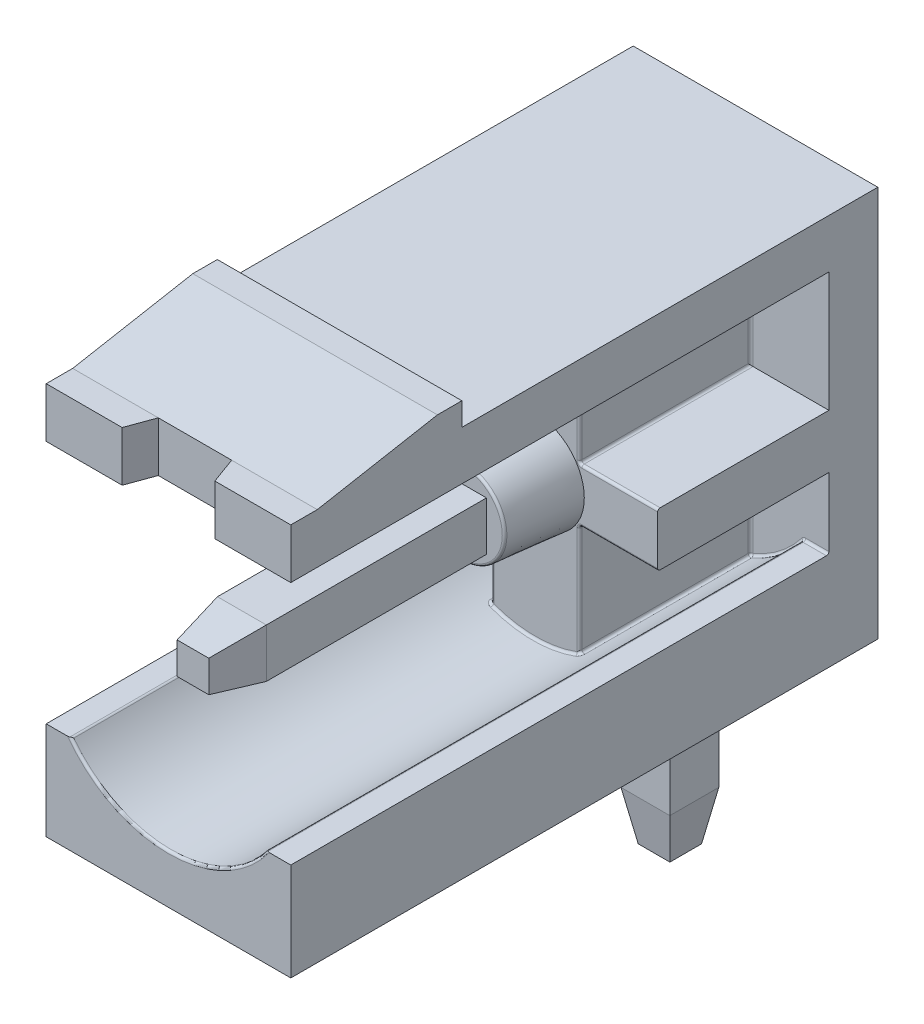
from build123d import *
from OCP.BRepFilletAPI import BRepFilletAPI_MakeChamfer

# Parameters (mm, degrees)
SKETCH_1_W                   = 5
SKETCH_1_H                   = 8
EXTRUDE_1_DEPTH              = 12
SKETCH_2_W                   = 5
SKETCH_2_H                   = 5
CUT_EXTRUDE_2_DEPTH          = 11
SKETCH_5_R                   = 2.5
CUT_EXTRUDE_3_DEPTH          = 11
EXTRUDE_START                = 3.5
SKETCH_13_W                  = 1.8
SKETCH_13_H                  = 1.1
SKETCH_13_H_2                = 2.45
SKETCH_13_W_2                = 1.6
EXTRUDE_13_DEPTH             = 3.5
SKETCH_14_R                  = 1
EXTRUDE_14_DEPTH             = 1.5
CHAMFER_1_SIZE               = 1.5
CHAMFER_1_SIZE_2             = 0.131232995
EXTRUDE_15_DEPTH             = 5
CUT_EXTRUDE_16_REACH         = 16.649
SKETCH_17_W                  = 1.2
SKETCH_17_H                  = 5
CUT_EXTRUDE_17_DEPTH         = 2.25
SKETCH_18_W                  = 3.5
SKETCH_18_H                  = 6
CUT_EXTRUDE_18_DEPTH         = 0.1
EXTRUDE_19_REACH             = 16.9
SKETCH_6_W                   = 1
SKETCH_6_H                   = 1
SKETCH_19_W                  = 1
SKETCH_19_H                  = 1
CUT_EXTRUDE_20_DEPTH         = 0.5
EXTRUDE_22_REACH             = 16.9
SKETCH_9_W                   = 1
SKETCH_9_H                   = 1
EXTRUDE_22_DIRECTION_2_DEPTH = 4
CHAMFER_2_SIZE               = 1
CHAMFER_2_SIZE2              = 0.176326981
CHAMFER_3_SIZE               = 1
CHAMFER_3_SIZE2              = 0.176326981
FILLET_3_R                   = 0.05


with BuildPart() as part:
    # Эскиз1 → Вытянуть1 (new body)
    with BuildSketch(Plane.XY):
        with Locations((0, 4)):
            Rectangle(SKETCH_1_W, SKETCH_1_H)
    extrude(amount=EXTRUDE_1_DEPTH)

    # Эскиз2 → Вытянуть2 (cut)
    with BuildSketch(Plane.XY.offset(12)):
        with Locations((0, 4.5)):
            Rectangle(SKETCH_2_W, SKETCH_2_H)
    extrude(amount=-CUT_EXTRUDE_2_DEPTH, mode=Mode.SUBTRACT)

    # Эскиз5 → Вытянуть3 (cut)
    with BuildSketch(Plane.XY.offset(12)):
        with Locations((0, 3.5)):
            Circle(SKETCH_5_R)
    extrude(amount=-CUT_EXTRUDE_3_DEPTH, mode=Mode.SUBTRACT)

    # Эскиз13 → Вытянуть13 (add)
    with BuildSketch(Plane.XY.offset(1).offset(EXTRUDE_START)):
        with Locations((0, 4)):
            Rectangle(SKETCH_13_W, SKETCH_13_H)
        with Locations((0, 5.775)):
            Rectangle(SKETCH_13_W, SKETCH_13_H_2)
        with Locations((-1.7, 4)):
            Rectangle(SKETCH_13_W_2, SKETCH_13_H)
        with BuildLine():
            ThreePointArc((-0.9, 1.167619242), (-0.457737974, 1.042262026), (0, 1))
            ThreePointArc((0, 1), (0.457737974, 1.042262026), (0.9, 1.167619242))
            Line((0.9, 1.167619242), (0.9, 3.45))
            Line((0.9, 3.45), (-0.9, 3.45))
            Line((-0.9, 3.45), (-0.9, 1.167619242))
        make_face()
        with Locations((1.7, 4)):
            Rectangle(SKETCH_13_W_2, SKETCH_13_H)
    extrude(amount=-EXTRUDE_13_DEPTH)

    # Эскиз14 → Вытянуть14 (add)
    with BuildSketch(Plane.XY.offset(4.5)):
        with Locations((0, 4)):
            Circle(SKETCH_14_R)
    extrude(amount=EXTRUDE_14_DEPTH)

    # Фаска1
    # the kernel refuses this chamfer: 1.5, 0.131232995 mm, written as the material it takes off along each edge
    with BuildSketch(Plane(origin=(0, 4, 6), x_dir=(1, 0, 0), z_dir=(0, -1, 0))) as chamfer_1_piece_1_section:
        Polygon((1, -CHAMFER_1_SIZE), (1 - CHAMFER_1_SIZE_2 * 1.0000000022, 0), (1, 0), align=None)
    chamfer_1_piece_1 = revolve(axis=Axis((0, 4, 6), (0, 0, 1)), mode=Mode.PRIVATE)
    chamfer_1_piece_1 = split(chamfer_1_piece_1, bisect_by=Plane(origin=(-0.941450204, 4, 4.5), z_dir=(0, 0, 1)), keep=Keep.TOP, mode=Mode.PRIVATE)
    add(chamfer_1_piece_1, mode=Mode.SUBTRACT)

    # Эскиз15 → Вытянуть15 (add)
    with BuildSketch(Plane(origin=(2.5, 0, 0), x_dir=(0, 0, -1), z_dir=(1, 0, 0))):
        Polygon((-12, 8), (-8.502371568, 8), (-8.502371568, 8.471155216), (-9.002629656, 8.471155216), (-11.45875482, 8.021948415), (-12, 8.021948415), align=None)
    extrude(amount=-EXTRUDE_15_DEPTH)

    # Эскиз16 → Вытянуть16 (cut, up to next)
    with BuildSketch(Plane(origin=(0, 8.021948415, 0), x_dir=(1, 0, 0), z_dir=(0, 1, 0)), mode=Mode.PRIVATE) as cut_extrude_16_sk1:
        Polygon((0.75, -11.45875482), (-0.75, -11.45875482), (-0.946997135, -12), (0.946997135, -12), align=None)
    cut_extrude_16_tool1 = extrude(cut_extrude_16_sk1.sketch, amount=-CUT_EXTRUDE_16_REACH, mode=Mode.PRIVATE) & part.part
    add(cut_extrude_16_tool1.solids().sort_by_distance((0, 8.021948, 11.739849))[0], mode=Mode.SUBTRACT)

    # Эскиз17 → Вытянуть17 (cut)
    with BuildSketch(Plane(origin=(0, 0, 0), x_dir=(-1, 0, 0), z_dir=(0, 0, -1))):
        with Locations((0, 2.5)):
            Rectangle(SKETCH_17_W, SKETCH_17_H)
    extrude(amount=-CUT_EXTRUDE_17_DEPTH, mode=Mode.SUBTRACT)

    # Эскиз18 → Вытянуть18 (cut)
    with BuildSketch(Plane(origin=(0, 0, 0), x_dir=(-1, 0, 0), z_dir=(0, 0, -1))):
        with Locations((0, 3)):
            Rectangle(SKETCH_18_W, SKETCH_18_H)
    extrude(amount=-CUT_EXTRUDE_18_DEPTH, mode=Mode.SUBTRACT)


with BuildPart() as body_2:

    # Эскиз6 → Вытянуть19 (new, up to next)
    with BuildSketch(Plane.XY.offset(12), mode=Mode.PRIVATE) as extrude_19_sk1:
        with Locations((0, 4)):
            Rectangle(SKETCH_6_W, SKETCH_6_H)
    extrude_19_tool1 = extrude(extrude_19_sk1.sketch, amount=-EXTRUDE_19_REACH, mode=Mode.PRIVATE) - part.part
    add(extrude_19_tool1.solids().sort_by_distance((0, 4, 12))[0])

    # Эскиз19 → Вытянуть20 (cut)
    with BuildSketch(Plane.XY.offset(12)):
        with Locations((0, 4)):
            Rectangle(SKETCH_19_W, SKETCH_19_H)
    extrude(amount=-CUT_EXTRUDE_20_DEPTH, mode=Mode.SUBTRACT)

    # Фаска2: one chamfer whose edges measure the first distance from different faces: ONE call of the kernel's chamfer builder (chamfer() names one face for all edges)
    chamfer_2_edges_1 = [body_2.edges().sort_by_distance(p)[0] for p in [
        (-0.5, 4, 11.5),
    ]]
    chamfer_2_side_1 = [body_2.faces().sort_by_distance(p)[0] for p in [
        (-0.5, 4, 8.75),
    ]]
    chamfer_2_edges_2 = [body_2.edges().sort_by_distance(p)[0] for p in [
        (0, 4.5, 11.5),
    ]]
    chamfer_2_side_2 = [body_2.faces().sort_by_distance(p)[0] for p in [
        (0, 4.5, 8.75),
    ]]
    chamfer_2_edges_3 = [body_2.edges().sort_by_distance(p)[0] for p in [
        (0.5, 4, 11.5),
    ]]
    chamfer_2_side_3 = [body_2.faces().sort_by_distance(p)[0] for p in [
        (0.5, 4, 8.75),
    ]]
    chamfer_2_edges_4 = [body_2.edges().sort_by_distance(p)[0] for p in [
        (0, 3.5, 11.5),
    ]]
    chamfer_2_side_4 = [body_2.faces().sort_by_distance(p)[0] for p in [
        (0, 3.5, 8.75),
    ]]
    chamfer_2 = BRepFilletAPI_MakeChamfer(body_2.part.solid().wrapped)
    for e in chamfer_2_edges_1:
        chamfer_2.Add(CHAMFER_2_SIZE, CHAMFER_2_SIZE2, e.wrapped, chamfer_2_side_1[0].wrapped)  # the first distance lies on this face
    for e in chamfer_2_edges_2:
        chamfer_2.Add(CHAMFER_2_SIZE, CHAMFER_2_SIZE2, e.wrapped, chamfer_2_side_2[0].wrapped)  # the first distance lies on this face
    for e in chamfer_2_edges_3:
        chamfer_2.Add(CHAMFER_2_SIZE, CHAMFER_2_SIZE2, e.wrapped, chamfer_2_side_3[0].wrapped)  # the first distance lies on this face
    for e in chamfer_2_edges_4:
        chamfer_2.Add(CHAMFER_2_SIZE, CHAMFER_2_SIZE2, e.wrapped, chamfer_2_side_4[0].wrapped)  # the first distance lies on this face
    add(Compound.cast(chamfer_2.Shape()), mode=Mode.REPLACE)


with BuildPart() as body_3:

    # Эскиз9 → Вытянуть22 (new, up to next)
    with BuildSketch(Plane.XZ, mode=Mode.PRIVATE) as extrude_22_sk1:
        with Locations((0, 1.75)):
            Rectangle(SKETCH_9_W, SKETCH_9_H)
    extrude_22_tool1 = extrude(extrude_22_sk1.sketch, amount=-EXTRUDE_22_REACH, mode=Mode.PRIVATE) - part.part
    add(extrude_22_tool1.solids().sort_by_distance((0, 0, 1.75))[0])

    # Эскиз9 → Вытянуть22 direction 2 (add)
    with BuildSketch(Plane.XZ):
        with Locations((0, 1.75)):
            Rectangle(SKETCH_9_W, SKETCH_9_H)
    extrude(amount=EXTRUDE_22_DIRECTION_2_DEPTH)

    # Фаска3: one chamfer whose edges measure the first distance from different faces: ONE call of the kernel's chamfer builder (chamfer() names one face for all edges)
    chamfer_3_edges_1 = [body_3.edges().sort_by_distance(p)[0] for p in [
        (-0.5, -4, 1.75),
    ]]
    chamfer_3_side_1 = [body_3.faces().sort_by_distance(p)[0] for p in [
        (-0.5, 0.5, 1.75),
    ]]
    chamfer_3_edges_2 = [body_3.edges().sort_by_distance(p)[0] for p in [
        (0, -4, 1.25),
    ]]
    chamfer_3_side_2 = [body_3.faces().sort_by_distance(p)[0] for p in [
        (0, 0.5, 1.25),
    ]]
    chamfer_3_edges_3 = [body_3.edges().sort_by_distance(p)[0] for p in [
        (0.5, -4, 1.75),
    ]]
    chamfer_3_side_3 = [body_3.faces().sort_by_distance(p)[0] for p in [
        (0.5, 0.5, 1.75),
    ]]
    chamfer_3_edges_4 = [body_3.edges().sort_by_distance(p)[0] for p in [
        (0, -4, 2.25),
    ]]
    chamfer_3_side_4 = [body_3.faces().sort_by_distance(p)[0] for p in [
        (0, 0.5, 2.25),
    ]]
    chamfer_3 = BRepFilletAPI_MakeChamfer(body_3.part.solid().wrapped)
    for e in chamfer_3_edges_1:
        chamfer_3.Add(CHAMFER_3_SIZE, CHAMFER_3_SIZE2, e.wrapped, chamfer_3_side_1[0].wrapped)  # the first distance lies on this face
    for e in chamfer_3_edges_2:
        chamfer_3.Add(CHAMFER_3_SIZE, CHAMFER_3_SIZE2, e.wrapped, chamfer_3_side_2[0].wrapped)  # the first distance lies on this face
    for e in chamfer_3_edges_3:
        chamfer_3.Add(CHAMFER_3_SIZE, CHAMFER_3_SIZE2, e.wrapped, chamfer_3_side_3[0].wrapped)  # the first distance lies on this face
    for e in chamfer_3_edges_4:
        chamfer_3.Add(CHAMFER_3_SIZE, CHAMFER_3_SIZE2, e.wrapped, chamfer_3_side_4[0].wrapped)  # the first distance lies on this face
    add(Compound.cast(chamfer_3.Shape()), mode=Mode.REPLACE)


with BuildPart() as part_1:
    add(part.part)

    # Скругление3
    fillet_3_edges = [part_1.edges().sort_by_distance(p)[0] for p in [
        (-2.25, 2, 1),
        (2.25, 2, 1),
        (0, 1, 12),
        (-1.508547126, 1.506438973, 1),
        (2, 2, 6.5),
        (-2, 2, 6.5),
        (1.508547126, 1.506438973, 1),
        (-0.9, 5.775, 4.5),
        (-0.9, 7, 2.75),
        (-1.7, 4.55, 4.5),
        (-0.9, 4.55, 2.75),
        (-0.9, 2.308809621, 4.5),
        (-0.9, 3.45, 2.75),
        (-0.9, 1.167619242, 2.75),
        (0.9, 2.308809621, 1),
        (0.9, 1.167619242, 2.75),
        (0.9, 3.45, 2.75),
        (1.7, 4.55, 4.5),
        (0.9, 5.775, 1),
        (0.9, 4.55, 2.75),
        (0.9, 7, 2.75),
        (-1.7, 3.45, 4.5),
        (0, 1, 4.5),
        (0.9, 2.308809621, 4.5),
        (1.7, 3.45, 4.5),
        (0.9, 5.775, 4.5),
        (0, 7, 4.5),
        (-0.9, 5.775, 1),
        (-0.9, 2.308809621, 1),
        (-0.868767005, 4, 6),
    ]]
    fillet(fillet_3_edges, radius=FILLET_3_R)


solid = Compound([body_2.part, body_3.part, part_1.part])
